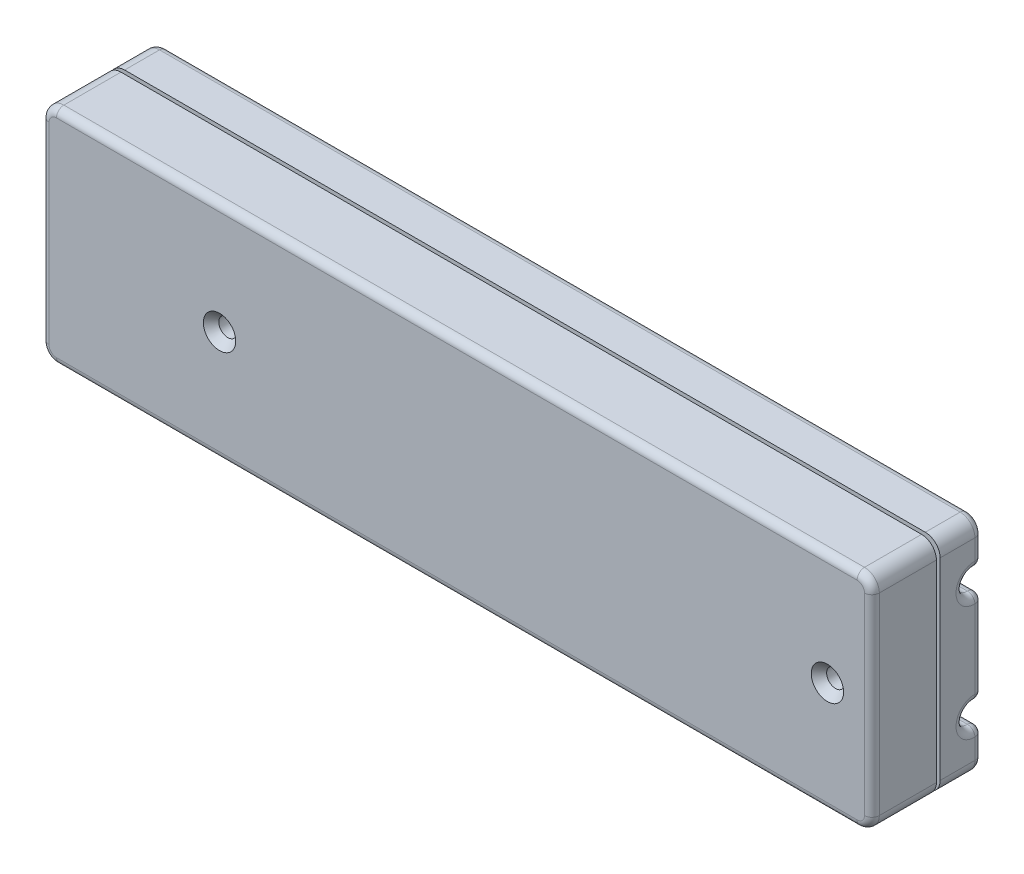
from build123d import *

# Parameters (mm, degrees)
BOSS_EXTRUDE1_DEPTH                           = 6
BOSS_EXTRUDE1_DEPTH_BACK                      = 8.9
SKETCH1_W                                     = 112
SKETCH1_H                                     = 30
FILLET2_R                                     = 2
CUT_EXTRUDE5_START                            = -7.33636
SKETCH11_R                                    = 1.5
CUT_EXTRUDE5_DEPTH                            = 7.33636
SHELL1_START                                  = -54
SHELL1_OUTLINE_W                              = 26
SHELL1_OUTLINE_H                              = 10.9
SHELL1_DEPTH                                  = 100.663640376
SHELL1_START_2                                = 46.663640376
SHELL1_2_DEPTH                                = 7.336359624
FILLET4_R                                     = 1
SKETCH3_R                                     = 3.7
SKETCH3_W                                     = 3.158
SKETCH3_H                                     = 5.645
CUT_EXTRUDE2_DEPTH                            = 2.2
FILLET3_R                                     = 0.75
SPLIT1_SURFACE_1_BACK                         = 117.902
SPLIT1_SURFACE_1_DEPTH                        = 235.804
SPLIT1_SURFACE_2_BACK                         = 117.902
SPLIT1_SURFACE_2_DEPTH                        = 235.804
BOSS_EXTRUDE2_START                           = -1
BOSS_EXTRUDE2_OUTLINE_R                       = 3
BOSS_EXTRUDE2_DEPTH                           = 3.308
CSK_FOR_2_FLAT_HEAD_MACHINE_SCREW1_AT_2_COUNT = 2
CSK_FOR_2_FLAT_HEAD_MACHINE_SCREW1_AT_2_PITCH = 82
LIP_GROOVE3_GROOVE_START                      = -3.2
LIP_GROOVE3_GROOVE_DEPTH                      = 1.5
LIP_GROOVE3_GROOVE_2_DEPTH                    = 0.5
LIP3_START                                    = -3.2
LIP3_DEPTH                                    = 1.5
BOSS_EXTRUDE3_START                           = 10.9
SKETCH5_4_R                                   = 3
BOSS_EXTRUDE3_DEPTH                           = 6.9
SKETCH6_R                                     = 1.5875
CUT_EXTRUDE3_DEPTH                            = 6.9
CUT_EXTRUDE6_START                            = -91.4
CUT_EXTRUDE6_DEPTH                            = 87.15
BOSS_EXTRUDE4_START                           = -4.25
BOSS_EXTRUDE4_DEPTH                           = 87.15
SKETCH13_W                                    = 2.308
SKETCH13_H                                    = 1.25
BOSS_EXTRUDE5_DEPTH                           = 103


with BuildPart() as part:
    # Sketch1 → Boss-Extrude1 (new, two sides: drawn at the far end of the back side and taken through both)
    with BuildSketch(Plane.XY.offset(-BOSS_EXTRUDE1_DEPTH_BACK)):
        Rectangle(SKETCH1_W, SKETCH1_H)
    extrude(amount=BOSS_EXTRUDE1_DEPTH + BOSS_EXTRUDE1_DEPTH_BACK)

    # Fillet2
    fillet2_edges = [part.edges().sort_by_distance(p)[0] for p in [
        (56, -15, -1.45),
        (-56, -15, -1.45),
        (-56, 15, -1.45),
        (56, 15, -1.45),
    ]]
    fillet(fillet2_edges, radius=FILLET2_R)

    # Sketch11 → Cut-Extrude5 (cut)
    with BuildSketch(Plane(origin=(56, 0, 0), x_dir=(0, 0, -1), z_dir=(1, 0, 0)).offset(CUT_EXTRUDE5_START)):
        with Locations((7.85, 7.78005)):
            Circle(SKETCH11_R)
        with Locations((7.85, -7.78005)):
            Circle(SKETCH11_R)
    extrude(amount=CUT_EXTRUDE5_DEPTH, mode=Mode.SUBTRACT)

    # Shell1: read off the stored shape, not the designer's step
    # Shell1 outline → Shell1 (cut)
    with BuildSketch(Plane.YZ.offset(SHELL1_START)):
        with Locations((0, -1.45)):
            Rectangle(SHELL1_OUTLINE_W, SHELL1_OUTLINE_H)
    extrude(amount=SHELL1_DEPTH, mode=Mode.SUBTRACT)

    # Shell1 2 outline → Shell1 2 (cut)
    with BuildSketch(Plane.YZ.offset(SHELL1_START_2)):
        with BuildLine():
            Line((11.148655053, -6.9), (13, -6.9))
            Line((13, -6.9), (13, 4))
            Line((13, 4), (-13, 4))
            Line((-13, 4), (-13, -6.9))
            Line((-13, -6.9), (-11.148655053, -6.9))
            ThreePointArc((-11.148655053, -6.9), (-7.78005, -4.35), (-4.411444947, -6.9))
            Line((-4.411444947, -6.9), (4.411444947, -6.9))
            ThreePointArc((4.411444947, -6.9), (7.78005, -4.35), (11.148655053, -6.9))
        make_face()
    extrude(amount=SHELL1_2_DEPTH, mode=Mode.SUBTRACT)

    # Fillet4
    fillet4_edges = [part.edges().sort_by_distance(p)[0] for p in [
        (56, -10.925632132, -8.9),
        (56, 0, 6),
        (0, -15, -8.9),
        (-56, 0, -8.9),
        (0, 15, -8.9),
        (-55.414213562, 14.414213562, -8.9),
        (-55.414213562, -14.414213562, -8.9),
        (55.414213562, 14.414213562, -8.9),
        (55.414213562, -14.414213562, -8.9),
        (0, -15, 6),
        (0, 15, 6),
        (-56, 0, 6),
        (-55.414213562, 14.414213562, 6),
        (-55.414213562, -14.414213562, 6),
        (55.414213562, 14.414213562, 6),
        (55.414213562, -14.414213562, 6),
        (56, 10.925632132, -8.9),
        (52.33182, 8.851264264, -8.9),
        (48.66364, 7.78005, -8.9),
        (52.33182, 6.708835736, -8.9),
        (56, 7.78005, -6.35),
        (56, 0, -8.9),
        (52.33182, -6.708835736, -8.9),
        (48.66364, -7.78005, -8.9),
        (52.33182, -8.851264264, -8.9),
        (56, -7.78005, -6.35),
    ]]
    fillet(fillet4_edges, radius=FILLET4_R)

    # Sketch3 → Cut-Extrude2 (cut)
    with BuildSketch(Plane.ZY.offset(56)):
        with Locations((-3.2, -6.925)):
            Circle(SKETCH3_R)
        with Locations((-3.2, 1.575)):
            Circle(SKETCH3_R)
        with Locations((2.421, 9.2775)):
            Rectangle(SKETCH3_W, SKETCH3_H)
    extrude(amount=-CUT_EXTRUDE2_DEPTH, mode=Mode.SUBTRACT)

    # Fillet3
    fillet3_edges = [part.edges().sort_by_distance(p)[0] for p in [
        (54, 13, -1.45),
        (-54, 13, -1.45),
        (-54, -13, -1.45),
        (54, -13, -1.45),
    ]]
    fillet(fillet3_edges, radius=FILLET3_R)


with BuildPart() as body_2:
    # Split1: the piece behind the surface
    add(part.part)
    # Split1 surface: a surface, the sketch's curves swept straight by 235.804 mm
    with BuildLine(Plane(origin=(0, 15, 0), x_dir=(1, 0, 0), z_dir=(0, 1, 0)).offset(-SPLIT1_SURFACE_1_BACK), mode=Mode.PRIVATE) as split1_surface_1_path:
        Line((-56, 3.2), (56, 3.2))
    split1_surface_1 = Shell.extrude(split1_surface_1_path.wire(), (0 * SPLIT1_SURFACE_1_DEPTH, 1 * SPLIT1_SURFACE_1_DEPTH, 0 * SPLIT1_SURFACE_1_DEPTH))
    split(bisect_by=split1_surface_1, keep=Keep.BOTTOM)

    # Boss-Extrude2: read off the stored shape, not the designer's step
    # Boss-Extrude2 outline → Boss-Extrude2 (add)
    with BuildSketch(Plane(origin=(0, 0, 4), x_dir=(-1, 0, 0), z_dir=(0, 0, -1)).offset(BOSS_EXTRUDE2_START)):
        with Locations((-50, 0)):
            Circle(BOSS_EXTRUDE2_OUTLINE_R)
        with Locations((32, 0)):
            Circle(BOSS_EXTRUDE2_OUTLINE_R)
    extrude(amount=BOSS_EXTRUDE2_DEPTH)

    # Sketch9 → CSK for #2 Flat Head Machine Screw1 (revolve, cut)
    with BuildSketch(Plane(origin=(-32, 0, 6), x_dir=(0, -1, 0), z_dir=(1, 0, 0))):
        Polygon((0, 0), (0, 4.732569267), (1.2192, 4), (1.2192, 1.110335587), (2.1844, 0), align=None)
    csk_for_2_flat_head_machine_screw1 = revolve(axis=Axis((-32, 0, 12.35), (0, 0, -1)), mode=Mode.SUBTRACT)

    # CSK for #2 Flat Head Machine Screw1 at 2: CSK for #2 Flat Head Machine Screw1 ×2
    with Locations(*[(i * CSK_FOR_2_FLAT_HEAD_MACHINE_SCREW1_AT_2_PITCH, 0, 0) for i in range(1, CSK_FOR_2_FLAT_HEAD_MACHINE_SCREW1_AT_2_COUNT)]):
        add(csk_for_2_flat_head_machine_screw1, mode=Mode.SUBTRACT)

    # Lip&Groove3-Groove: read off the stored shape, not the designer's step
    # Lip&Groove3-Groove outline → Lip&Groove3-Groove (cut)
    with BuildSketch(Plane.XY.offset(LIP_GROOVE3_GROOVE_START)):
        with BuildLine():
            ThreePointArc((-53.25, 14), (-54.487436867, 13.487436867), (-55, 12.25))
            Line((-55, 12.25), (-55, 4.957306905))
            Line((-55, 4.957306905), (-54, 4.957306905))
            Line((-54, 4.957306905), (-54, 12.25))
            ThreePointArc((-54, 12.25), (-53.780330086, 12.780330086), (-53.25, 13))
            Line((-53.25, 13), (53.25, 13))
            ThreePointArc((53.25, 13), (53.780330086, 12.780330086), (54, 12.25))
            Line((54, 12.25), (54, -12.25))
            ThreePointArc((54, -12.25), (53.780330086, -12.780330086), (53.25, -13))
            Line((53.25, -13), (-53.25, -13))
            ThreePointArc((-53.25, -13), (-53.780330086, -12.780330086), (-54, -12.25))
            Line((-54, -12.25), (-54, -10.307306905))
            Line((-54, -10.307306905), (-55, -10.307306905))
            Line((-55, -10.307306905), (-55, -12.25))
            ThreePointArc((-55, -12.25), (-54.487436867, -13.487436867), (-53.25, -14))
            Line((-53.25, -14), (53.25, -14))
            ThreePointArc((53.25, -14), (54.487436867, -13.487436867), (55, -12.25))
            Line((55, -12.25), (55, 12.25))
            ThreePointArc((55, 12.25), (54.487436867, 13.487436867), (53.25, 14))
            Line((53.25, 14), (-53.25, 14))
        make_face()
    extrude(amount=LIP_GROOVE3_GROOVE_DEPTH, mode=Mode.SUBTRACT)

    # Lip_Groove3-Groove 2 outline → Lip_Groove3-Groove 2 (cut)
    with BuildSketch(Plane.XY.offset(LIP_GROOVE3_GROOVE_START)):
        with BuildLine():
            ThreePointArc((-55, 12.25), (-54.487436867, 13.487436867), (-53.25, 14))
            Line((-53.25, 14), (53.25, 14))
            ThreePointArc((53.25, 14), (54.487436867, 13.487436867), (55, 12.25))
            Line((55, 12.25), (55, -12.25))
            ThreePointArc((55, -12.25), (54.487436867, -13.487436867), (53.25, -14))
            Line((53.25, -14), (-53.25, -14))
            ThreePointArc((-53.25, -14), (-54.487436867, -13.487436867), (-55, -12.25))
            Line((-55, -12.25), (-55, -10.591060556))
            Line((-55, -10.591060556), (-56, -10.591060556))
            Line((-56, -10.591060556), (-56, -13))
            ThreePointArc((-56, -13), (-55.414213562, -14.414213562), (-54, -15))
            Line((-54, -15), (54, -15))
            ThreePointArc((54, -15), (55.414213562, -14.414213562), (56, -13))
            Line((56, -13), (56, 13))
            ThreePointArc((56, 13), (55.414213562, 14.414213562), (54, 15))
            Line((54, 15), (-54, 15))
            ThreePointArc((-54, 15), (-55.414213562, 14.414213562), (-56, 13))
            Line((-56, 13), (-56, 5.241060556))
            Line((-56, 5.241060556), (-55, 5.241060556))
            Line((-55, 5.241060556), (-55, 12.25))
        make_face()
    extrude(amount=LIP_GROOVE3_GROOVE_2_DEPTH, mode=Mode.SUBTRACT)

    # Sketch13 → Boss-Extrude5 (add)
    with BuildSketch(Plane(origin=(56, 0, 0), x_dir=(0, 0, -1), z_dir=(1, 0, 0))):
        with Locations((-2.846, -12.375)):
            Rectangle(SKETCH13_W, SKETCH13_H)
        with Locations((-2.846, 12.375)):
            Rectangle(SKETCH13_W, SKETCH13_H)
    extrude(amount=-BOSS_EXTRUDE5_DEPTH)


with BuildPart() as part_1:
    add(part.part)

    # Split1: split by a surface, the side it looks to stays
    # Split1 surface: a surface, the sketch's curves swept straight by 235.804 mm
    with BuildLine(Plane(origin=(0, 15, 0), x_dir=(1, 0, 0), z_dir=(0, 1, 0)).offset(-SPLIT1_SURFACE_2_BACK), mode=Mode.PRIVATE) as split1_surface_2_path:
        Line((-56, 3.2), (56, 3.2))
    split1_surface_2 = Shell.extrude(split1_surface_2_path.wire(), (0 * SPLIT1_SURFACE_2_DEPTH, 1 * SPLIT1_SURFACE_2_DEPTH, 0 * SPLIT1_SURFACE_2_DEPTH))
    split(bisect_by=split1_surface_2, keep=Keep.TOP)

    # Lip3: read off the stored shape, not the designer's step
    # Lip3 outline → Lip3 (add)
    with BuildSketch(Plane.XY.offset(LIP3_START)):
        with BuildLine():
            Line((54, 12.25), (54, -12.25))
            ThreePointArc((54, -12.25), (53.780330086, -12.780330086), (53.25, -13))
            Line((53.25, -13), (-53.25, -13))
            ThreePointArc((-53.25, -13), (-53.780330086, -12.780330086), (-54, -12.25))
            Line((-54, -12.25), (-54, -10.625))
            Line((-54, -10.625), (-55, -10.625))
            Line((-55, -10.625), (-55, -12.25))
            ThreePointArc((-55, -12.25), (-54.487436867, -13.487436867), (-53.25, -14))
            Line((-53.25, -14), (53.25, -14))
            ThreePointArc((53.25, -14), (54.487436867, -13.487436867), (55, -12.25))
            Line((55, -12.25), (55, 12.25))
            ThreePointArc((55, 12.25), (54.487436867, 13.487436867), (53.25, 14))
            Line((53.25, 14), (-53.25, 14))
            ThreePointArc((-53.25, 14), (-54.487436867, 13.487436867), (-55, 12.25))
            Line((-55, 12.25), (-55, 5.275))
            Line((-55, 5.275), (-54, 5.275))
            Line((-54, 5.275), (-54, 12.25))
            ThreePointArc((-54, 12.25), (-53.780330086, 12.780330086), (-53.25, 13))
            Line((-53.25, 13), (53.25, 13))
            ThreePointArc((53.25, 13), (53.780330086, 12.780330086), (54, 12.25))
        make_face()
    extrude(amount=LIP3_DEPTH)

    # Sketch5<4> → Boss-Extrude3 (add)
    with BuildSketch(Plane(origin=(0, 0, 4), x_dir=(-1, 0, 0), z_dir=(0, 0, -1)).offset(BOSS_EXTRUDE3_START)):
        with Locations((32, 0)):
            Circle(SKETCH5_4_R)
        with Locations((-50, 0)):
            Circle(SKETCH5_4_R)
    extrude(amount=-BOSS_EXTRUDE3_DEPTH)

    # Sketch6 → Cut-Extrude3 (cut)
    with BuildSketch(Plane.XY):
        with Locations((-32, 0)):
            Circle(SKETCH6_R)
        with Locations((50, 0)):
            Circle(SKETCH6_R)
    extrude(amount=-CUT_EXTRUDE3_DEPTH, mode=Mode.SUBTRACT)

    # Cut-Extrude6: read off the stored shape, not the designer's step
    # Cut-Extrude6 outline → Cut-Extrude6 (cut)
    with BuildSketch(Plane(origin=(56, 0, 0), x_dir=(0, 0, -1), z_dir=(1, 0, 0)).offset(CUT_EXTRUDE6_START)):
        with BuildLine():
            Line((6.9, -13), (7.9, -13))
            Line((7.9, -13), (7.9, -10.951689203))
            Line((7.9, -10.951689203), (8.9, -10.93894761))
            Line((8.9, -10.93894761), (8.9, -4.62115239))
            Line((8.9, -4.62115239), (6.411244107, -4.589441675))
            ThreePointArc((6.411244107, -4.589441675), (4.359676418, -8.040129391), (6.9, -11.148655053))
            Line((6.9, -11.148655053), (6.9, -13))
        make_face()
    cut_extrude6 = extrude(amount=CUT_EXTRUDE6_DEPTH, mode=Mode.SUBTRACT)

    # Sketch12<4> → Boss-Extrude4 (add)
    with BuildSketch(Plane(origin=(56, 0, 0), x_dir=(0, 0, -1), z_dir=(1, 0, 0)).offset(BOSS_EXTRUDE4_START)):
        Polygon((7.9, -13), (7.9, -10.951689203), (1.75, -11.03005), (1.75, -11.75), (0, -11.75), (0, -13), align=None)
        Polygon((1.75, -4.53005), (7.9, -4.608410797), (7.9, -2.03005), (1.75, -2.03005), align=None)
    boss_extrude4 = extrude(amount=-BOSS_EXTRUDE4_DEPTH)

    # Mirror2: Cut-Extrude6, Boss-Extrude4 across plane
    add(cut_extrude6.mirror(Plane.ZX), mode=Mode.SUBTRACT)
    add(boss_extrude4.mirror(Plane.ZX))


solid = Compound([body_2.part, part_1.part])
